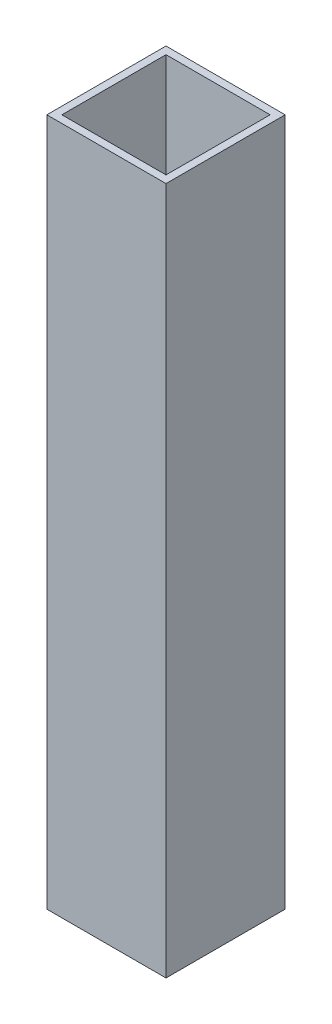
from build123d import *

# Parameters (mm, degrees)
SKETCH1_W           = 19.05
SKETCH1_H           = 19.05
BOSS_EXTRUDE1_DEPTH = 110
SKETCH2_W           = 16.65
SKETCH2_H           = 16.65
CUT_EXTRUDE3_DEPTH  = 111.82170929


with BuildPart() as part:
    # Sketch1 → Boss-Extrude1 (new body)
    with BuildSketch(Plane(origin=(0, 0, 0), x_dir=(1, 0, 0), z_dir=(0, 1, 0))):
        Rectangle(SKETCH1_W, SKETCH1_H)
    extrude(amount=BOSS_EXTRUDE1_DEPTH)

    # Sketch2 → Cut-Extrude3 (cut, through all)
    with BuildSketch(Plane(origin=(0, 0, 0), x_dir=(1, 0, 0), z_dir=(0, 1, 0))):
        Rectangle(SKETCH2_W, SKETCH2_H)
    extrude(amount=CUT_EXTRUDE3_DEPTH, mode=Mode.SUBTRACT)


solid = part.part
